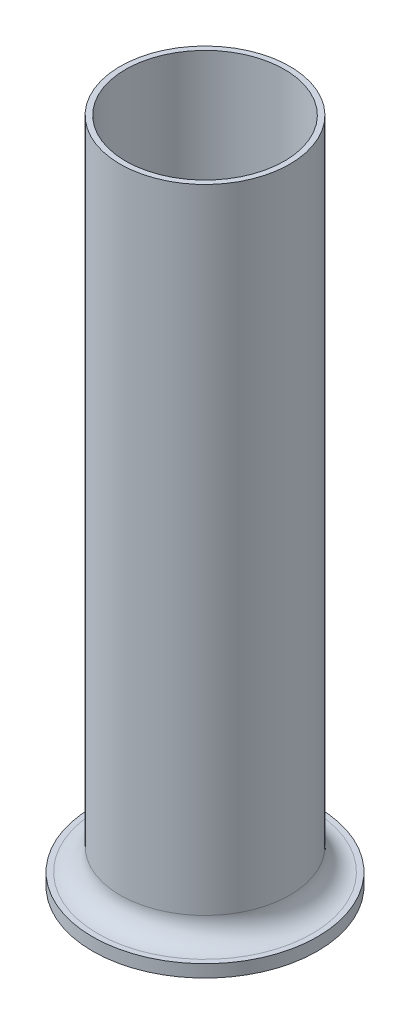
from build123d import *

# Parameters (mm, degrees)
SKETCH_1_R          = 25.25
EXTRUDE_1_DEPTH     = 2.8
SKETCH_2_R          = 19.05
EXTRUDE_2_DEPTH     = 147.2
FILLET_1_R          = 5
SKETCH_3_R          = 17.85
CUT_EXTRUDE_1_DEPTH = 155.191844791
SKETCH_5_R          = 1.8


with BuildPart() as part:
    # 스케치1 → 보스-돌출1 (new body)
    with BuildSketch(Plane(origin=(0, 0, 0), x_dir=(1, 0, 0), z_dir=(0, 1, 0))):
        Circle(SKETCH_1_R)
    extrude(amount=EXTRUDE_1_DEPTH)

    # 스케치2 → 보스-돌출2 (add)
    with BuildSketch(Plane(origin=(0, 2.8, 0), x_dir=(1, 0, 0), z_dir=(0, 1, 0))):
        Circle(SKETCH_2_R)
    extrude(amount=EXTRUDE_2_DEPTH)

    # 필렛1
    fillet_1_edges = [part.edges().sort_by_distance(p)[0] for p in [
        (-19.05, 2.8, 0),
    ]]
    fillet(fillet_1_edges, radius=FILLET_1_R)

    # 스케치3 → 컷-돌출1 (cut, through all)
    with BuildSketch(Plane(origin=(0, 150, 0), x_dir=(1, 0, 0), z_dir=(0, 1, 0))):
        Circle(SKETCH_3_R)
    extrude(amount=-CUT_EXTRUDE_1_DEPTH, mode=Mode.SUBTRACT)

    # 컷-스윕1: sweep along a path in 스케치4
    with BuildLine(Plane.XZ) as sweep_1_path:
        CenterArc((0, 0), 21.75, 0, 360)
    # 스케치5 → 컷-스윕1 (sweep, cut)
    with BuildSketch(Plane.XY):
        with Locations((-21.75, 0)):
            Circle(SKETCH_5_R)
    sweep(path=sweep_1_path.line, mode=Mode.SUBTRACT)


solid = part.part
